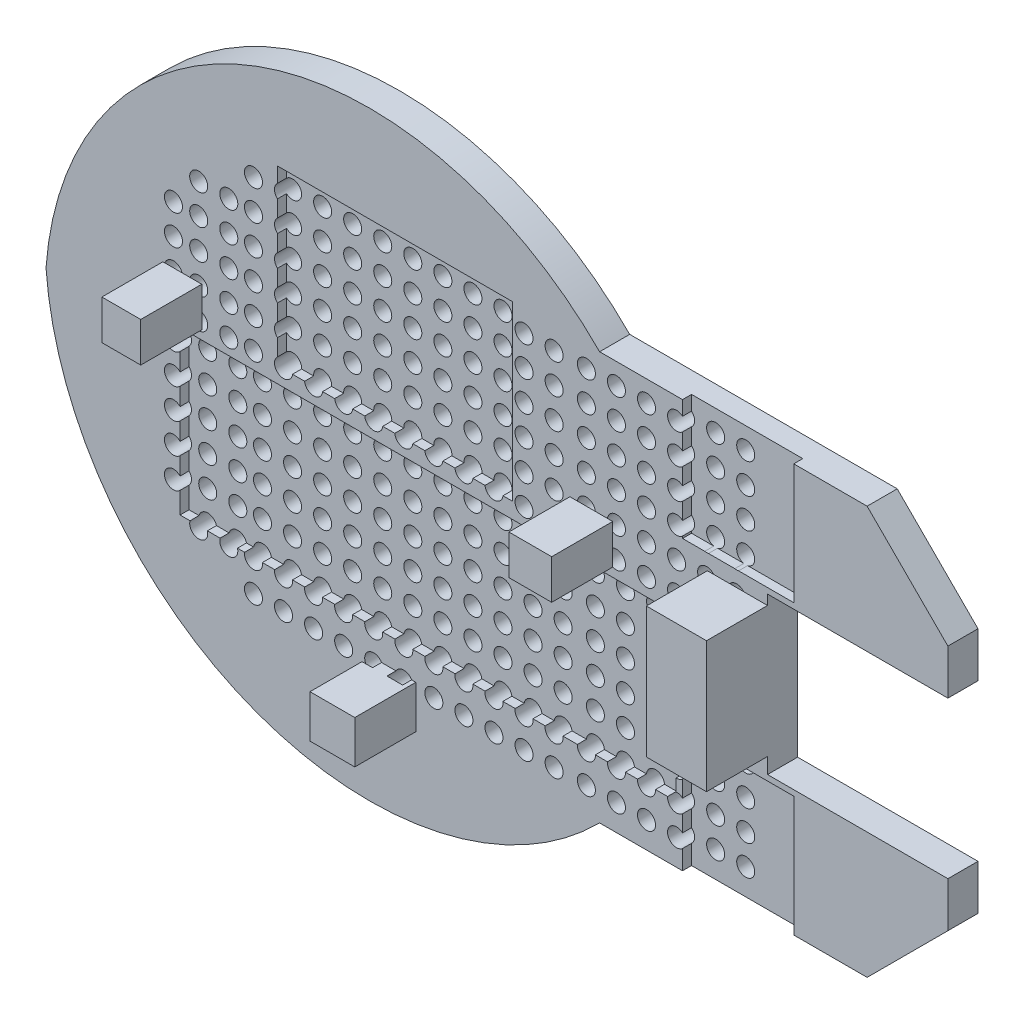
from build123d import *

# Parameters (mm, degrees)
BOSS_EXTRUDE1_DEPTH      = 10
BOSS_EXTRUDE1_DEPTH_BACK = 0.01
SKETCH3_W                = 37
SKETCH3_H                = 40
CUT_EXTRUDE1_DEPTH       = 3
SKETCH5_W                = 37
SKETCH5_H                = 40
CUT_EXTRUDE3_DEPTH       = 3
SKETCH7_W                = 165
SKETCH7_H                = 54
CUT_EXTRUDE4_DEPTH       = 3
SKETCH8_W                = 78.2
SKETCH8_H                = 57.5
CUT_EXTRUDE5_DEPTH       = 3
SKETCH9_W                = 12.924332112
SKETCH9_H                = 13.143388588
SKETCH9_W_2              = 14.238670971
SKETCH9_W_3              = 14.8958404
SKETCH9_H_2              = 14.23867097
BOSS_EXTRUDE2_DEPTH      = 20.3
SKETCH11_R               = 3
CUT_EXTRUDE12_DEPTH      = 13
CUT_EXTRUDE13_REACH      = 263.683
SKETCH12_R               = 3
CUT_EXTRUDE14_REACH      = 263.683
SKETCH13_R               = 3
SKETCH14_R               = 3
CUT_EXTRUDE16_DEPTH      = 10.01
SKETCH15_W               = 20
SKETCH15_H               = 43.5
BOSS_EXTRUDE3_DEPTH      = 20.3


with BuildPart() as part:
    # Sketch1 → Boss-Extrude1 (new, two sides: drawn at the far end of the back side and taken through both)
    with BuildSketch(Plane.XY.offset(-BOSS_EXTRUDE1_DEPTH_BACK)):
        with BuildLine():
            Line((0, 0), (0, -26))
            Line((0, -26), (60, -26))
            Line((60, -26), (60, -41))
            Line((60, -41), (33.129942315, -67.870057685))
            Line((33.129942315, -67.870057685), (-55.850057685, -67.870057685))
            ThreePointArc((-55.850057685, -67.870057685), (-169.745893523, -93.14097487), (-240, 0))
            ThreePointArc((-240, 0), (-169.745893523, 93.14097487), (-55.850057685, 67.870057685))
            Line((-55.850057685, 67.870057685), (33.129942315, 67.870057685))
            Line((33.129942315, 67.870057685), (60, 41))
            Line((60, 41), (60, 26))
            Line((60, 26), (0, 26))
            Line((0, 26), (0, 0))
        make_face()
    extrude(amount=BOSS_EXTRUDE1_DEPTH + BOSS_EXTRUDE1_DEPTH_BACK)

    # Sketch3 → Cut-Extrude1 (cut)
    with BuildSketch(Plane.XY.offset(10)):
        with Locations((-9.773002586, 47.870057685)):
            Rectangle(SKETCH3_W, SKETCH3_H)
    extrude(amount=-CUT_EXTRUDE1_DEPTH, mode=Mode.SUBTRACT)

    # Sketch5 → Cut-Extrude3 (cut)
    with BuildSketch(Plane.XY.offset(10)):
        with Locations((-9.773002586, -47.870057685)):
            Rectangle(SKETCH5_W, SKETCH5_H)
    extrude(amount=-CUT_EXTRUDE3_DEPTH, mode=Mode.SUBTRACT)

    # Sketch7 → Cut-Extrude4 (cut)
    with BuildSketch(Plane.XY.offset(10)):
        with Locations((-112.913094129, -21.943838981)):
            Rectangle(SKETCH7_W, SKETCH7_H)
    extrude(amount=-CUT_EXTRUDE4_DEPTH, mode=Mode.SUBTRACT)

    # Sketch8 → Cut-Extrude5 (cut)
    with BuildSketch(Plane.XY.offset(10)):
        with Locations((-123.892735612, 39.063262975)):
            Rectangle(SKETCH8_W, SKETCH8_H)
    extrude(amount=-CUT_EXTRUDE5_DEPTH, mode=Mode.SUBTRACT)

    # Sketch9 → Boss-Extrude2 (add)
    with BuildSketch(Plane.XY.offset(10)):
        with Locations((-194.646396461, 14.582539194)):
            Rectangle(SKETCH9_W, SKETCH9_H)
        with Locations((-58.612324577, 14.582539194)):
            Rectangle(SKETCH9_W_2, SKETCH9_H)
        with Locations((-124.438795754, -65.044490001)):
            Rectangle(SKETCH9_W_3, SKETCH9_H_2)
    extrude(amount=BOSS_EXTRUDE2_DEPTH)

    # Sketch11 → Cut-Extrude12 (cut)
    with BuildSketch(Plane(origin=(0, 0, -0.01), x_dir=(-1, 0, 0), z_dir=(0, 0, -1))):
        with Locations((70.989015497, 60.584399251)):
            Circle(SKETCH11_R)
        with Locations((80.989015497, 60.584399251)):
            Circle(SKETCH11_R)
        with Locations((90.989015497, 60.584399251)):
            Circle(SKETCH11_R)
        with Locations((100.989015497, 60.584399251)):
            Circle(SKETCH11_R)
        with Locations((110.989015497, 60.584399251)):
            Circle(SKETCH11_R)
        with Locations((120.989015497, 60.584399251)):
            Circle(SKETCH11_R)
        with Locations((130.989015497, 60.584399251)):
            Circle(SKETCH11_R)
        with Locations((140.989015497, 60.584399251)):
            Circle(SKETCH11_R)
        with Locations((150.989015497, 60.584399251)):
            Circle(SKETCH11_R)
        with Locations((160.989015497, 60.584399251)):
            Circle(SKETCH11_R)
        with Locations((170.989015497, 60.584399251)):
            Circle(SKETCH11_R)
        with Locations((80.989015497, 50.584399251)):
            Circle(SKETCH11_R)
        with Locations((90.989015497, 50.584399251)):
            Circle(SKETCH11_R)
        with Locations((100.989015497, 50.584399251)):
            Circle(SKETCH11_R)
        with Locations((110.989015497, 50.584399251)):
            Circle(SKETCH11_R)
        with Locations((120.989015497, 50.584399251)):
            Circle(SKETCH11_R)
        with Locations((130.989015497, 50.584399251)):
            Circle(SKETCH11_R)
        with Locations((140.989015497, 50.584399251)):
            Circle(SKETCH11_R)
        with Locations((150.989015497, 50.584399251)):
            Circle(SKETCH11_R)
        with Locations((160.989015497, 50.584399251)):
            Circle(SKETCH11_R)
        with Locations((170.989015497, 50.584399251)):
            Circle(SKETCH11_R)
        with Locations((80.989015497, 40.584399251)):
            Circle(SKETCH11_R)
        with Locations((90.989015497, 40.584399251)):
            Circle(SKETCH11_R)
        with Locations((100.989015497, 40.584399251)):
            Circle(SKETCH11_R)
        with Locations((110.989015497, 40.584399251)):
            Circle(SKETCH11_R)
        with Locations((120.989015497, 40.584399251)):
            Circle(SKETCH11_R)
        with Locations((130.989015497, 40.584399251)):
            Circle(SKETCH11_R)
        with Locations((140.989015497, 40.584399251)):
            Circle(SKETCH11_R)
        with Locations((150.989015497, 40.584399251)):
            Circle(SKETCH11_R)
        with Locations((160.989015497, 40.584399251)):
            Circle(SKETCH11_R)
        with Locations((170.989015497, 40.584399251)):
            Circle(SKETCH11_R)
        with Locations((80.989015497, 30.584399251)):
            Circle(SKETCH11_R)
        with Locations((90.989015497, 30.584399251)):
            Circle(SKETCH11_R)
        with Locations((100.989015497, 30.584399251)):
            Circle(SKETCH11_R)
        with Locations((110.989015497, 30.584399251)):
            Circle(SKETCH11_R)
        with Locations((120.989015497, 30.584399251)):
            Circle(SKETCH11_R)
        with Locations((130.989015497, 30.584399251)):
            Circle(SKETCH11_R)
        with Locations((140.989015497, 30.584399251)):
            Circle(SKETCH11_R)
        with Locations((150.989015497, 30.584399251)):
            Circle(SKETCH11_R)
        with Locations((160.989015497, 30.584399251)):
            Circle(SKETCH11_R)
        with Locations((170.989015497, 30.584399251)):
            Circle(SKETCH11_R)
        with Locations((80.989015497, 20.584399251)):
            Circle(SKETCH11_R)
        with Locations((90.989015497, 20.584399251)):
            Circle(SKETCH11_R)
        with Locations((100.989015497, 20.584399251)):
            Circle(SKETCH11_R)
        with Locations((110.989015497, 20.584399251)):
            Circle(SKETCH11_R)
        with Locations((120.989015497, 20.584399251)):
            Circle(SKETCH11_R)
        with Locations((130.989015497, 20.584399251)):
            Circle(SKETCH11_R)
        with Locations((140.989015497, 20.584399251)):
            Circle(SKETCH11_R)
        with Locations((150.989015497, 20.584399251)):
            Circle(SKETCH11_R)
        with Locations((160.989015497, 20.584399251)):
            Circle(SKETCH11_R)
        with Locations((170.989015497, 20.584399251)):
            Circle(SKETCH11_R)
        with Locations((80.989015497, 10.584399251)):
            Circle(SKETCH11_R)
        with Locations((90.989015497, 10.584399251)):
            Circle(SKETCH11_R)
        with Locations((100.989015497, 10.584399251)):
            Circle(SKETCH11_R)
        with Locations((110.989015497, 10.584399251)):
            Circle(SKETCH11_R)
        with Locations((120.989015497, 10.584399251)):
            Circle(SKETCH11_R)
        with Locations((130.989015497, 10.584399251)):
            Circle(SKETCH11_R)
        with Locations((140.989015497, 10.584399251)):
            Circle(SKETCH11_R)
        with Locations((150.989015497, 10.584399251)):
            Circle(SKETCH11_R)
        with Locations((160.989015497, 10.584399251)):
            Circle(SKETCH11_R)
        with Locations((170.989015497, 10.584399251)):
            Circle(SKETCH11_R)
        with Locations((80.989015497, 0.584399251)):
            Circle(SKETCH11_R)
        with Locations((90.989015497, 0.584399251)):
            Circle(SKETCH11_R)
        with Locations((100.989015497, 0.584399251)):
            Circle(SKETCH11_R)
        with Locations((110.989015497, 0.584399251)):
            Circle(SKETCH11_R)
        with Locations((120.989015497, 0.584399251)):
            Circle(SKETCH11_R)
        with Locations((130.989015497, 0.584399251)):
            Circle(SKETCH11_R)
        with Locations((140.989015497, 0.584399251)):
            Circle(SKETCH11_R)
        with Locations((150.989015497, 0.584399251)):
            Circle(SKETCH11_R)
        with Locations((160.989015497, 0.584399251)):
            Circle(SKETCH11_R)
        with Locations((170.989015497, 0.584399251)):
            Circle(SKETCH11_R)
        with Locations((80.989015497, -9.415600749)):
            Circle(SKETCH11_R)
        with Locations((90.989015497, -9.415600749)):
            Circle(SKETCH11_R)
        with Locations((100.989015497, -9.415600749)):
            Circle(SKETCH11_R)
        with Locations((110.989015497, -9.415600749)):
            Circle(SKETCH11_R)
        with Locations((120.989015497, -9.415600749)):
            Circle(SKETCH11_R)
        with Locations((130.989015497, -9.415600749)):
            Circle(SKETCH11_R)
        with Locations((140.989015497, -9.415600749)):
            Circle(SKETCH11_R)
        with Locations((150.989015497, -9.415600749)):
            Circle(SKETCH11_R)
        with Locations((160.989015497, -9.415600749)):
            Circle(SKETCH11_R)
        with Locations((170.989015497, -9.415600749)):
            Circle(SKETCH11_R)
        with Locations((80.989015497, -19.415600749)):
            Circle(SKETCH11_R)
        with Locations((90.989015497, -19.415600749)):
            Circle(SKETCH11_R)
        with Locations((100.989015497, -19.415600749)):
            Circle(SKETCH11_R)
        with Locations((110.989015497, -19.415600749)):
            Circle(SKETCH11_R)
        with Locations((120.989015497, -19.415600749)):
            Circle(SKETCH11_R)
        with Locations((130.989015497, -19.415600749)):
            Circle(SKETCH11_R)
        with Locations((140.989015497, -19.415600749)):
            Circle(SKETCH11_R)
        with Locations((150.989015497, -19.415600749)):
            Circle(SKETCH11_R)
        with Locations((160.989015497, -19.415600749)):
            Circle(SKETCH11_R)
        with Locations((170.989015497, -19.415600749)):
            Circle(SKETCH11_R)
        with Locations((80.989015497, -29.415600749)):
            Circle(SKETCH11_R)
        with Locations((90.989015497, -29.415600749)):
            Circle(SKETCH11_R)
        with Locations((100.989015497, -29.415600749)):
            Circle(SKETCH11_R)
        with Locations((110.989015497, -29.415600749)):
            Circle(SKETCH11_R)
        with Locations((120.989015497, -29.415600749)):
            Circle(SKETCH11_R)
        with Locations((130.989015497, -29.415600749)):
            Circle(SKETCH11_R)
        with Locations((140.989015497, -29.415600749)):
            Circle(SKETCH11_R)
        with Locations((150.989015497, -29.415600749)):
            Circle(SKETCH11_R)
        with Locations((160.989015497, -29.415600749)):
            Circle(SKETCH11_R)
        with Locations((170.989015497, -29.415600749)):
            Circle(SKETCH11_R)
        with Locations((80.989015497, -39.415600749)):
            Circle(SKETCH11_R)
        with Locations((90.989015497, -39.415600749)):
            Circle(SKETCH11_R)
        with Locations((100.989015497, -39.415600749)):
            Circle(SKETCH11_R)
        with Locations((110.989015497, -39.415600749)):
            Circle(SKETCH11_R)
        with Locations((120.989015497, -39.415600749)):
            Circle(SKETCH11_R)
        with Locations((130.989015497, -39.415600749)):
            Circle(SKETCH11_R)
        with Locations((140.989015497, -39.415600749)):
            Circle(SKETCH11_R)
        with Locations((150.989015497, -39.415600749)):
            Circle(SKETCH11_R)
        with Locations((160.989015497, -39.415600749)):
            Circle(SKETCH11_R)
        with Locations((170.989015497, -39.415600749)):
            Circle(SKETCH11_R)
        with Locations((80.989015497, -49.415600749)):
            Circle(SKETCH11_R)
        with Locations((90.989015497, -49.415600749)):
            Circle(SKETCH11_R)
        with Locations((100.989015497, -49.415600749)):
            Circle(SKETCH11_R)
        with Locations((110.989015497, -49.415600749)):
            Circle(SKETCH11_R)
        with Locations((120.989015497, -49.415600749)):
            Circle(SKETCH11_R)
        with Locations((130.989015497, -49.415600749)):
            Circle(SKETCH11_R)
        with Locations((140.989015497, -49.415600749)):
            Circle(SKETCH11_R)
        with Locations((150.989015497, -49.415600749)):
            Circle(SKETCH11_R)
        with Locations((160.989015497, -49.415600749)):
            Circle(SKETCH11_R)
        with Locations((170.989015497, -49.415600749)):
            Circle(SKETCH11_R)
        with Locations((80.989015497, -59.415600749)):
            Circle(SKETCH11_R)
        with Locations((90.989015497, -59.415600749)):
            Circle(SKETCH11_R)
        with Locations((100.989015497, -59.415600749)):
            Circle(SKETCH11_R)
        with Locations((110.989015497, -59.415600749)):
            Circle(SKETCH11_R)
        with Locations((120.989015497, -59.415600749)):
            Circle(SKETCH11_R)
        with Locations((130.989015497, -59.415600749)):
            Circle(SKETCH11_R)
        with Locations((140.989015497, -59.415600749)):
            Circle(SKETCH11_R)
        with Locations((150.989015497, -59.415600749)):
            Circle(SKETCH11_R)
        with Locations((160.989015497, -59.415600749)):
            Circle(SKETCH11_R)
        with Locations((170.989015497, -59.415600749)):
            Circle(SKETCH11_R)
        with Locations((70.989015497, 50.584399251)):
            Circle(SKETCH11_R)
        with Locations((70.989015497, 40.584399251)):
            Circle(SKETCH11_R)
        with Locations((70.989015497, 30.584399251)):
            Circle(SKETCH11_R)
        with Locations((70.989015497, 20.584399251)):
            Circle(SKETCH11_R)
        with Locations((70.989015497, 10.584399251)):
            Circle(SKETCH11_R)
        with Locations((70.989015497, 0.584399251)):
            Circle(SKETCH11_R)
        with Locations((70.989015497, -9.415600749)):
            Circle(SKETCH11_R)
        with Locations((70.989015497, -19.415600749)):
            Circle(SKETCH11_R)
        with Locations((70.989015497, -29.415600749)):
            Circle(SKETCH11_R)
        with Locations((70.989015497, -39.415600749)):
            Circle(SKETCH11_R)
        with Locations((70.989015497, -49.415600749)):
            Circle(SKETCH11_R)
        with Locations((70.989015497, -59.415600749)):
            Circle(SKETCH11_R)
    extrude(amount=-CUT_EXTRUDE12_DEPTH, mode=Mode.SUBTRACT)

    # Cut-Extrude13: up to this face of the body (flat: up to its plane)
    cut_extrude13_end = Plane(part.part.faces().sort_by_distance((56.396717085, 33.5, 10))[0])
    # Sketch12 → Cut-Extrude13 (cut, up to the picked face)
    with BuildSketch(Plane(origin=(0, 0, -0.01), x_dir=(-1, 0, 0), z_dir=(0, 0, -1)), mode=Mode.PRIVATE) as cut_extrude13_sk1:
        with Locations((179.20291487, 50.26025315)):
            Circle(SKETCH12_R)
    cut_extrude13_tool1 = split(extrude(cut_extrude13_sk1.sketch, amount=-CUT_EXTRUDE13_REACH, mode=Mode.PRIVATE), bisect_by=cut_extrude13_end, keep=Keep.BOTH, mode=Mode.PRIVATE)
    # Sketch12 → Cut-Extrude13 (cut, up to the picked face)
    with BuildSketch(Plane(origin=(0, 0, -0.01), x_dir=(-1, 0, 0), z_dir=(0, 0, -1)), mode=Mode.PRIVATE) as cut_extrude13_sk2:
        with Locations((189.20291487, 50.26025315)):
            Circle(SKETCH12_R)
    cut_extrude13_tool2 = split(extrude(cut_extrude13_sk2.sketch, amount=-CUT_EXTRUDE13_REACH, mode=Mode.PRIVATE), bisect_by=cut_extrude13_end, keep=Keep.BOTH, mode=Mode.PRIVATE)
    # Sketch12 → Cut-Extrude13 (cut, up to the picked face)
    with BuildSketch(Plane(origin=(0, 0, -0.01), x_dir=(-1, 0, 0), z_dir=(0, 0, -1)), mode=Mode.PRIVATE) as cut_extrude13_sk3:
        with Locations((189.20291487, 40.26025315)):
            Circle(SKETCH12_R)
    cut_extrude13_tool3 = split(extrude(cut_extrude13_sk3.sketch, amount=-CUT_EXTRUDE13_REACH, mode=Mode.PRIVATE), bisect_by=cut_extrude13_end, keep=Keep.BOTH, mode=Mode.PRIVATE)
    # Sketch12 → Cut-Extrude13 (cut, up to the picked face)
    with BuildSketch(Plane(origin=(0, 0, -0.01), x_dir=(-1, 0, 0), z_dir=(0, 0, -1)), mode=Mode.PRIVATE) as cut_extrude13_sk4:
        with Locations((189.20291487, 30.26025315)):
            Circle(SKETCH12_R)
    cut_extrude13_tool4 = split(extrude(cut_extrude13_sk4.sketch, amount=-CUT_EXTRUDE13_REACH, mode=Mode.PRIVATE), bisect_by=cut_extrude13_end, keep=Keep.BOTH, mode=Mode.PRIVATE)
    # Sketch12 → Cut-Extrude13 (cut, up to the picked face)
    with BuildSketch(Plane(origin=(0, 0, -0.01), x_dir=(-1, 0, 0), z_dir=(0, 0, -1)), mode=Mode.PRIVATE) as cut_extrude13_sk5:
        with Locations((189.20291487, 20.26025315)):
            Circle(SKETCH12_R)
    cut_extrude13_tool5 = split(extrude(cut_extrude13_sk5.sketch, amount=-CUT_EXTRUDE13_REACH, mode=Mode.PRIVATE), bisect_by=cut_extrude13_end, keep=Keep.BOTH, mode=Mode.PRIVATE)
    # Sketch12 → Cut-Extrude13 (cut, up to the picked face)
    with BuildSketch(Plane(origin=(0, 0, -0.01), x_dir=(-1, 0, 0), z_dir=(0, 0, -1)), mode=Mode.PRIVATE) as cut_extrude13_sk6:
        with Locations((189.20291487, 10.26025315)):
            Circle(SKETCH12_R)
    cut_extrude13_tool6 = split(extrude(cut_extrude13_sk6.sketch, amount=-CUT_EXTRUDE13_REACH, mode=Mode.PRIVATE), bisect_by=cut_extrude13_end, keep=Keep.BOTH, mode=Mode.PRIVATE)
    # Sketch12 → Cut-Extrude13 (cut, up to the picked face)
    with BuildSketch(Plane(origin=(0, 0, -0.01), x_dir=(-1, 0, 0), z_dir=(0, 0, -1)), mode=Mode.PRIVATE) as cut_extrude13_sk7:
        with Locations((189.20291487, 0.26025315)):
            Circle(SKETCH12_R)
    cut_extrude13_tool7 = split(extrude(cut_extrude13_sk7.sketch, amount=-CUT_EXTRUDE13_REACH, mode=Mode.PRIVATE), bisect_by=cut_extrude13_end, keep=Keep.BOTH, mode=Mode.PRIVATE)
    # Sketch12 → Cut-Extrude13 (cut, up to the picked face)
    with BuildSketch(Plane(origin=(0, 0, -0.01), x_dir=(-1, 0, 0), z_dir=(0, 0, -1)), mode=Mode.PRIVATE) as cut_extrude13_sk8:
        with Locations((189.20291487, -9.73974685)):
            Circle(SKETCH12_R)
    cut_extrude13_tool8 = split(extrude(cut_extrude13_sk8.sketch, amount=-CUT_EXTRUDE13_REACH, mode=Mode.PRIVATE), bisect_by=cut_extrude13_end, keep=Keep.BOTH, mode=Mode.PRIVATE)
    # Sketch12 → Cut-Extrude13 (cut, up to the picked face)
    with BuildSketch(Plane(origin=(0, 0, -0.01), x_dir=(-1, 0, 0), z_dir=(0, 0, -1)), mode=Mode.PRIVATE) as cut_extrude13_sk9:
        with Locations((189.20291487, -19.73974685)):
            Circle(SKETCH12_R)
    cut_extrude13_tool9 = split(extrude(cut_extrude13_sk9.sketch, amount=-CUT_EXTRUDE13_REACH, mode=Mode.PRIVATE), bisect_by=cut_extrude13_end, keep=Keep.BOTH, mode=Mode.PRIVATE)
    # Sketch12 → Cut-Extrude13 (cut, up to the picked face)
    with BuildSketch(Plane(origin=(0, 0, -0.01), x_dir=(-1, 0, 0), z_dir=(0, 0, -1)), mode=Mode.PRIVATE) as cut_extrude13_sk10:
        with Locations((189.20291487, -29.73974685)):
            Circle(SKETCH12_R)
    cut_extrude13_tool10 = split(extrude(cut_extrude13_sk10.sketch, amount=-CUT_EXTRUDE13_REACH, mode=Mode.PRIVATE), bisect_by=cut_extrude13_end, keep=Keep.BOTH, mode=Mode.PRIVATE)
    # Sketch12 → Cut-Extrude13 (cut, up to the picked face)
    with BuildSketch(Plane(origin=(0, 0, -0.01), x_dir=(-1, 0, 0), z_dir=(0, 0, -1)), mode=Mode.PRIVATE) as cut_extrude13_sk11:
        with Locations((189.20291487, -39.73974685)):
            Circle(SKETCH12_R)
    cut_extrude13_tool11 = split(extrude(cut_extrude13_sk11.sketch, amount=-CUT_EXTRUDE13_REACH, mode=Mode.PRIVATE), bisect_by=cut_extrude13_end, keep=Keep.BOTH, mode=Mode.PRIVATE)
    # Sketch12 → Cut-Extrude13 (cut, up to the picked face)
    with BuildSketch(Plane(origin=(0, 0, -0.01), x_dir=(-1, 0, 0), z_dir=(0, 0, -1)), mode=Mode.PRIVATE) as cut_extrude13_sk12:
        with Locations((189.20291487, -49.73974685)):
            Circle(SKETCH12_R)
    cut_extrude13_tool12 = split(extrude(cut_extrude13_sk12.sketch, amount=-CUT_EXTRUDE13_REACH, mode=Mode.PRIVATE), bisect_by=cut_extrude13_end, keep=Keep.BOTH, mode=Mode.PRIVATE)
    # Sketch12 → Cut-Extrude13 (cut, up to the picked face)
    with BuildSketch(Plane(origin=(0, 0, -0.01), x_dir=(-1, 0, 0), z_dir=(0, 0, -1)), mode=Mode.PRIVATE) as cut_extrude13_sk13:
        with Locations((179.20291487, 40.26025315)):
            Circle(SKETCH12_R)
    cut_extrude13_tool13 = split(extrude(cut_extrude13_sk13.sketch, amount=-CUT_EXTRUDE13_REACH, mode=Mode.PRIVATE), bisect_by=cut_extrude13_end, keep=Keep.BOTH, mode=Mode.PRIVATE)
    # Sketch12 → Cut-Extrude13 (cut, up to the picked face)
    with BuildSketch(Plane(origin=(0, 0, -0.01), x_dir=(-1, 0, 0), z_dir=(0, 0, -1)), mode=Mode.PRIVATE) as cut_extrude13_sk14:
        with Locations((179.20291487, 30.26025315)):
            Circle(SKETCH12_R)
    cut_extrude13_tool14 = split(extrude(cut_extrude13_sk14.sketch, amount=-CUT_EXTRUDE13_REACH, mode=Mode.PRIVATE), bisect_by=cut_extrude13_end, keep=Keep.BOTH, mode=Mode.PRIVATE)
    # Sketch12 → Cut-Extrude13 (cut, up to the picked face)
    with BuildSketch(Plane(origin=(0, 0, -0.01), x_dir=(-1, 0, 0), z_dir=(0, 0, -1)), mode=Mode.PRIVATE) as cut_extrude13_sk15:
        with Locations((179.20291487, 20.26025315)):
            Circle(SKETCH12_R)
    cut_extrude13_tool15 = split(extrude(cut_extrude13_sk15.sketch, amount=-CUT_EXTRUDE13_REACH, mode=Mode.PRIVATE), bisect_by=cut_extrude13_end, keep=Keep.BOTH, mode=Mode.PRIVATE)
    # Sketch12 → Cut-Extrude13 (cut, up to the picked face)
    with BuildSketch(Plane(origin=(0, 0, -0.01), x_dir=(-1, 0, 0), z_dir=(0, 0, -1)), mode=Mode.PRIVATE) as cut_extrude13_sk16:
        with Locations((179.20291487, 10.26025315)):
            Circle(SKETCH12_R)
    cut_extrude13_tool16 = split(extrude(cut_extrude13_sk16.sketch, amount=-CUT_EXTRUDE13_REACH, mode=Mode.PRIVATE), bisect_by=cut_extrude13_end, keep=Keep.BOTH, mode=Mode.PRIVATE)
    # Sketch12 → Cut-Extrude13 (cut, up to the picked face)
    with BuildSketch(Plane(origin=(0, 0, -0.01), x_dir=(-1, 0, 0), z_dir=(0, 0, -1)), mode=Mode.PRIVATE) as cut_extrude13_sk17:
        with Locations((179.20291487, 0.26025315)):
            Circle(SKETCH12_R)
    cut_extrude13_tool17 = split(extrude(cut_extrude13_sk17.sketch, amount=-CUT_EXTRUDE13_REACH, mode=Mode.PRIVATE), bisect_by=cut_extrude13_end, keep=Keep.BOTH, mode=Mode.PRIVATE)
    # Sketch12 → Cut-Extrude13 (cut, up to the picked face)
    with BuildSketch(Plane(origin=(0, 0, -0.01), x_dir=(-1, 0, 0), z_dir=(0, 0, -1)), mode=Mode.PRIVATE) as cut_extrude13_sk18:
        with Locations((179.20291487, -9.73974685)):
            Circle(SKETCH12_R)
    cut_extrude13_tool18 = split(extrude(cut_extrude13_sk18.sketch, amount=-CUT_EXTRUDE13_REACH, mode=Mode.PRIVATE), bisect_by=cut_extrude13_end, keep=Keep.BOTH, mode=Mode.PRIVATE)
    # Sketch12 → Cut-Extrude13 (cut, up to the picked face)
    with BuildSketch(Plane(origin=(0, 0, -0.01), x_dir=(-1, 0, 0), z_dir=(0, 0, -1)), mode=Mode.PRIVATE) as cut_extrude13_sk19:
        with Locations((179.20291487, -19.73974685)):
            Circle(SKETCH12_R)
    cut_extrude13_tool19 = split(extrude(cut_extrude13_sk19.sketch, amount=-CUT_EXTRUDE13_REACH, mode=Mode.PRIVATE), bisect_by=cut_extrude13_end, keep=Keep.BOTH, mode=Mode.PRIVATE)
    # Sketch12 → Cut-Extrude13 (cut, up to the picked face)
    with BuildSketch(Plane(origin=(0, 0, -0.01), x_dir=(-1, 0, 0), z_dir=(0, 0, -1)), mode=Mode.PRIVATE) as cut_extrude13_sk20:
        with Locations((179.20291487, -29.73974685)):
            Circle(SKETCH12_R)
    cut_extrude13_tool20 = split(extrude(cut_extrude13_sk20.sketch, amount=-CUT_EXTRUDE13_REACH, mode=Mode.PRIVATE), bisect_by=cut_extrude13_end, keep=Keep.BOTH, mode=Mode.PRIVATE)
    # Sketch12 → Cut-Extrude13 (cut, up to the picked face)
    with BuildSketch(Plane(origin=(0, 0, -0.01), x_dir=(-1, 0, 0), z_dir=(0, 0, -1)), mode=Mode.PRIVATE) as cut_extrude13_sk21:
        with Locations((179.20291487, -39.73974685)):
            Circle(SKETCH12_R)
    cut_extrude13_tool21 = split(extrude(cut_extrude13_sk21.sketch, amount=-CUT_EXTRUDE13_REACH, mode=Mode.PRIVATE), bisect_by=cut_extrude13_end, keep=Keep.BOTH, mode=Mode.PRIVATE)
    # Sketch12 → Cut-Extrude13 (cut, up to the picked face)
    with BuildSketch(Plane(origin=(0, 0, -0.01), x_dir=(-1, 0, 0), z_dir=(0, 0, -1)), mode=Mode.PRIVATE) as cut_extrude13_sk22:
        with Locations((179.20291487, -49.73974685)):
            Circle(SKETCH12_R)
    cut_extrude13_tool22 = split(extrude(cut_extrude13_sk22.sketch, amount=-CUT_EXTRUDE13_REACH, mode=Mode.PRIVATE), bisect_by=cut_extrude13_end, keep=Keep.BOTH, mode=Mode.PRIVATE)
    add(cut_extrude13_tool1.solids().sort_by(Axis((-179.202915, 50.260253, -0.01), (0, 0, 1)))[0], mode=Mode.SUBTRACT)
    add(cut_extrude13_tool2.solids().sort_by(Axis((-189.202915, 50.260253, -0.01), (0, 0, 1)))[0], mode=Mode.SUBTRACT)
    add(cut_extrude13_tool3.solids().sort_by(Axis((-189.202915, 40.260253, -0.01), (0, 0, 1)))[0], mode=Mode.SUBTRACT)
    add(cut_extrude13_tool4.solids().sort_by(Axis((-189.202915, 30.260253, -0.01), (0, 0, 1)))[0], mode=Mode.SUBTRACT)
    add(cut_extrude13_tool5.solids().sort_by(Axis((-189.202915, 20.260253, -0.01), (0, 0, 1)))[0], mode=Mode.SUBTRACT)
    add(cut_extrude13_tool6.solids().sort_by(Axis((-189.202915, 10.260253, -0.01), (0, 0, 1)))[0], mode=Mode.SUBTRACT)
    add(cut_extrude13_tool7.solids().sort_by(Axis((-189.202915, 0.260253, -0.01), (0, 0, 1)))[0], mode=Mode.SUBTRACT)
    add(cut_extrude13_tool8.solids().sort_by(Axis((-189.202915, -9.739747, -0.01), (0, 0, 1)))[0], mode=Mode.SUBTRACT)
    add(cut_extrude13_tool9.solids().sort_by(Axis((-189.202915, -19.739747, -0.01), (0, 0, 1)))[0], mode=Mode.SUBTRACT)
    add(cut_extrude13_tool10.solids().sort_by(Axis((-189.202915, -29.739747, -0.01), (0, 0, 1)))[0], mode=Mode.SUBTRACT)
    add(cut_extrude13_tool11.solids().sort_by(Axis((-189.202915, -39.739747, -0.01), (0, 0, 1)))[0], mode=Mode.SUBTRACT)
    add(cut_extrude13_tool12.solids().sort_by(Axis((-189.202915, -49.739747, -0.01), (0, 0, 1)))[0], mode=Mode.SUBTRACT)
    add(cut_extrude13_tool13.solids().sort_by(Axis((-179.202915, 40.260253, -0.01), (0, 0, 1)))[0], mode=Mode.SUBTRACT)
    add(cut_extrude13_tool14.solids().sort_by(Axis((-179.202915, 30.260253, -0.01), (0, 0, 1)))[0], mode=Mode.SUBTRACT)
    add(cut_extrude13_tool15.solids().sort_by(Axis((-179.202915, 20.260253, -0.01), (0, 0, 1)))[0], mode=Mode.SUBTRACT)
    add(cut_extrude13_tool16.solids().sort_by(Axis((-179.202915, 10.260253, -0.01), (0, 0, 1)))[0], mode=Mode.SUBTRACT)
    add(cut_extrude13_tool17.solids().sort_by(Axis((-179.202915, 0.260253, -0.01), (0, 0, 1)))[0], mode=Mode.SUBTRACT)
    add(cut_extrude13_tool18.solids().sort_by(Axis((-179.202915, -9.739747, -0.01), (0, 0, 1)))[0], mode=Mode.SUBTRACT)
    add(cut_extrude13_tool19.solids().sort_by(Axis((-179.202915, -19.739747, -0.01), (0, 0, 1)))[0], mode=Mode.SUBTRACT)
    add(cut_extrude13_tool20.solids().sort_by(Axis((-179.202915, -29.739747, -0.01), (0, 0, 1)))[0], mode=Mode.SUBTRACT)
    add(cut_extrude13_tool21.solids().sort_by(Axis((-179.202915, -39.739747, -0.01), (0, 0, 1)))[0], mode=Mode.SUBTRACT)
    add(cut_extrude13_tool22.solids().sort_by(Axis((-179.202915, -49.739747, -0.01), (0, 0, 1)))[0], mode=Mode.SUBTRACT)

    # Cut-Extrude14: up to this face of the body (flat: up to its plane)
    cut_extrude14_end = Plane(part.part.faces().sort_by_distance((56.396717085, 33.5, 10))[0])
    # Sketch13 → Cut-Extrude14 (cut, up to the picked face)
    with BuildSketch(Plane(origin=(0, 0, -0.01), x_dir=(-1, 0, 0), z_dir=(0, 0, -1)), mode=Mode.PRIVATE) as cut_extrude14_sk1:
        with Locations((197.603658893, 40.21214694)):
            Circle(SKETCH13_R)
    cut_extrude14_tool1 = split(extrude(cut_extrude14_sk1.sketch, amount=-CUT_EXTRUDE14_REACH, mode=Mode.PRIVATE), bisect_by=cut_extrude14_end, keep=Keep.BOTH, mode=Mode.PRIVATE)
    # Sketch13 → Cut-Extrude14 (cut, up to the picked face)
    with BuildSketch(Plane(origin=(0, 0, -0.01), x_dir=(-1, 0, 0), z_dir=(0, 0, -1)), mode=Mode.PRIVATE) as cut_extrude14_sk2:
        with Locations((197.603658893, 30.21214694)):
            Circle(SKETCH13_R)
    cut_extrude14_tool2 = split(extrude(cut_extrude14_sk2.sketch, amount=-CUT_EXTRUDE14_REACH, mode=Mode.PRIVATE), bisect_by=cut_extrude14_end, keep=Keep.BOTH, mode=Mode.PRIVATE)
    # Sketch13 → Cut-Extrude14 (cut, up to the picked face)
    with BuildSketch(Plane(origin=(0, 0, -0.01), x_dir=(-1, 0, 0), z_dir=(0, 0, -1)), mode=Mode.PRIVATE) as cut_extrude14_sk3:
        with Locations((197.603658893, 20.21214694)):
            Circle(SKETCH13_R)
    cut_extrude14_tool3 = split(extrude(cut_extrude14_sk3.sketch, amount=-CUT_EXTRUDE14_REACH, mode=Mode.PRIVATE), bisect_by=cut_extrude14_end, keep=Keep.BOTH, mode=Mode.PRIVATE)
    # Sketch13 → Cut-Extrude14 (cut, up to the picked face)
    with BuildSketch(Plane(origin=(0, 0, -0.01), x_dir=(-1, 0, 0), z_dir=(0, 0, -1)), mode=Mode.PRIVATE) as cut_extrude14_sk4:
        with Locations((197.603658893, 10.21214694)):
            Circle(SKETCH13_R)
    cut_extrude14_tool4 = split(extrude(cut_extrude14_sk4.sketch, amount=-CUT_EXTRUDE14_REACH, mode=Mode.PRIVATE), bisect_by=cut_extrude14_end, keep=Keep.BOTH, mode=Mode.PRIVATE)
    # Sketch13 → Cut-Extrude14 (cut, up to the picked face)
    with BuildSketch(Plane(origin=(0, 0, -0.01), x_dir=(-1, 0, 0), z_dir=(0, 0, -1)), mode=Mode.PRIVATE) as cut_extrude14_sk5:
        with Locations((197.603658893, 0.21214694)):
            Circle(SKETCH13_R)
    cut_extrude14_tool5 = split(extrude(cut_extrude14_sk5.sketch, amount=-CUT_EXTRUDE14_REACH, mode=Mode.PRIVATE), bisect_by=cut_extrude14_end, keep=Keep.BOTH, mode=Mode.PRIVATE)
    # Sketch13 → Cut-Extrude14 (cut, up to the picked face)
    with BuildSketch(Plane(origin=(0, 0, -0.01), x_dir=(-1, 0, 0), z_dir=(0, 0, -1)), mode=Mode.PRIVATE) as cut_extrude14_sk6:
        with Locations((197.603658893, -9.78785306)):
            Circle(SKETCH13_R)
    cut_extrude14_tool6 = split(extrude(cut_extrude14_sk6.sketch, amount=-CUT_EXTRUDE14_REACH, mode=Mode.PRIVATE), bisect_by=cut_extrude14_end, keep=Keep.BOTH, mode=Mode.PRIVATE)
    # Sketch13 → Cut-Extrude14 (cut, up to the picked face)
    with BuildSketch(Plane(origin=(0, 0, -0.01), x_dir=(-1, 0, 0), z_dir=(0, 0, -1)), mode=Mode.PRIVATE) as cut_extrude14_sk7:
        with Locations((197.603658893, -19.78785306)):
            Circle(SKETCH13_R)
    cut_extrude14_tool7 = split(extrude(cut_extrude14_sk7.sketch, amount=-CUT_EXTRUDE14_REACH, mode=Mode.PRIVATE), bisect_by=cut_extrude14_end, keep=Keep.BOTH, mode=Mode.PRIVATE)
    # Sketch13 → Cut-Extrude14 (cut, up to the picked face)
    with BuildSketch(Plane(origin=(0, 0, -0.01), x_dir=(-1, 0, 0), z_dir=(0, 0, -1)), mode=Mode.PRIVATE) as cut_extrude14_sk8:
        with Locations((197.603658893, -29.78785306)):
            Circle(SKETCH13_R)
    cut_extrude14_tool8 = split(extrude(cut_extrude14_sk8.sketch, amount=-CUT_EXTRUDE14_REACH, mode=Mode.PRIVATE), bisect_by=cut_extrude14_end, keep=Keep.BOTH, mode=Mode.PRIVATE)
    # Sketch13 → Cut-Extrude14 (cut, up to the picked face)
    with BuildSketch(Plane(origin=(0, 0, -0.01), x_dir=(-1, 0, 0), z_dir=(0, 0, -1)), mode=Mode.PRIVATE) as cut_extrude14_sk9:
        with Locations((197.603658893, -39.78785306)):
            Circle(SKETCH13_R)
    cut_extrude14_tool9 = split(extrude(cut_extrude14_sk9.sketch, amount=-CUT_EXTRUDE14_REACH, mode=Mode.PRIVATE), bisect_by=cut_extrude14_end, keep=Keep.BOTH, mode=Mode.PRIVATE)
    add(cut_extrude14_tool1.solids().sort_by(Axis((-197.603659, 40.212147, -0.01), (0, 0, 1)))[0], mode=Mode.SUBTRACT)
    add(cut_extrude14_tool2.solids().sort_by(Axis((-197.603659, 30.212147, -0.01), (0, 0, 1)))[0], mode=Mode.SUBTRACT)
    add(cut_extrude14_tool3.solids().sort_by(Axis((-197.603659, 20.212147, -0.01), (0, 0, 1)))[0], mode=Mode.SUBTRACT)
    add(cut_extrude14_tool4.solids().sort_by(Axis((-197.603659, 10.212147, -0.01), (0, 0, 1)))[0], mode=Mode.SUBTRACT)
    add(cut_extrude14_tool5.solids().sort_by(Axis((-197.603659, 0.212147, -0.01), (0, 0, 1)))[0], mode=Mode.SUBTRACT)
    add(cut_extrude14_tool6.solids().sort_by(Axis((-197.603659, -9.787853, -0.01), (0, 0, 1)))[0], mode=Mode.SUBTRACT)
    add(cut_extrude14_tool7.solids().sort_by(Axis((-197.603659, -19.787853, -0.01), (0, 0, 1)))[0], mode=Mode.SUBTRACT)
    add(cut_extrude14_tool8.solids().sort_by(Axis((-197.603659, -29.787853, -0.01), (0, 0, 1)))[0], mode=Mode.SUBTRACT)
    add(cut_extrude14_tool9.solids().sort_by(Axis((-197.603659, -39.787853, -0.01), (0, 0, 1)))[0], mode=Mode.SUBTRACT)

    # Sketch14 → Cut-Extrude16 (cut)
    with BuildSketch(Plane(origin=(0, 0, -0.01), x_dir=(-1, 0, 0), z_dir=(0, 0, -1))):
        with Locations((60.25524815, 60.803455728)):
            Circle(SKETCH14_R)
        with Locations((50.25524815, 60.803455728)):
            Circle(SKETCH14_R)
        with Locations((40.25524815, 60.803455728)):
            Circle(SKETCH14_R)
        with Locations((30.25524815, 60.803455728)):
            Circle(SKETCH14_R)
        with Locations((20.25524815, 60.803455728)):
            Circle(SKETCH14_R)
        with Locations((10.25524815, 60.803455728)):
            Circle(SKETCH14_R)
        with Locations((50.25524815, 50.803455728)):
            Circle(SKETCH14_R)
        with Locations((40.25524815, 50.803455728)):
            Circle(SKETCH14_R)
        with Locations((30.25524815, 50.803455728)):
            Circle(SKETCH14_R)
        with Locations((20.25524815, 50.803455728)):
            Circle(SKETCH14_R)
        with Locations((10.25524815, 50.803455728)):
            Circle(SKETCH14_R)
        with Locations((50.25524815, 40.803455728)):
            Circle(SKETCH14_R)
        with Locations((40.25524815, 40.803455728)):
            Circle(SKETCH14_R)
        with Locations((30.25524815, 40.803455728)):
            Circle(SKETCH14_R)
        with Locations((20.25524815, 40.803455728)):
            Circle(SKETCH14_R)
        with Locations((10.25524815, 40.803455728)):
            Circle(SKETCH14_R)
        with Locations((50.25524815, 30.803455728)):
            Circle(SKETCH14_R)
        with Locations((40.25524815, 30.803455728)):
            Circle(SKETCH14_R)
        with Locations((30.25524815, 30.803455728)):
            Circle(SKETCH14_R)
        with Locations((20.25524815, 30.803455728)):
            Circle(SKETCH14_R)
        with Locations((10.25524815, 30.803455728)):
            Circle(SKETCH14_R)
        with Locations((50.25524815, 20.803455728)):
            Circle(SKETCH14_R)
        with Locations((40.25524815, 20.803455728)):
            Circle(SKETCH14_R)
        with Locations((30.25524815, 20.803455728)):
            Circle(SKETCH14_R)
        with Locations((20.25524815, 20.803455728)):
            Circle(SKETCH14_R)
        with Locations((10.25524815, 20.803455728)):
            Circle(SKETCH14_R)
        with Locations((50.25524815, 10.803455728)):
            Circle(SKETCH14_R)
        with Locations((40.25524815, 10.803455728)):
            Circle(SKETCH14_R)
        with Locations((30.25524815, 10.803455728)):
            Circle(SKETCH14_R)
        with Locations((20.25524815, 10.803455728)):
            Circle(SKETCH14_R)
        with Locations((10.25524815, 10.803455728)):
            Circle(SKETCH14_R)
        with Locations((50.25524815, 0.803455728)):
            Circle(SKETCH14_R)
        with Locations((40.25524815, 0.803455728)):
            Circle(SKETCH14_R)
        with Locations((30.25524815, 0.803455728)):
            Circle(SKETCH14_R)
        with Locations((20.25524815, 0.803455728)):
            Circle(SKETCH14_R)
        with Locations((10.25524815, 0.803455728)):
            Circle(SKETCH14_R)
        with Locations((50.25524815, -9.196544272)):
            Circle(SKETCH14_R)
        with Locations((40.25524815, -9.196544272)):
            Circle(SKETCH14_R)
        with Locations((30.25524815, -9.196544272)):
            Circle(SKETCH14_R)
        with Locations((20.25524815, -9.196544272)):
            Circle(SKETCH14_R)
        with Locations((10.25524815, -9.196544272)):
            Circle(SKETCH14_R)
        with Locations((50.25524815, -19.196544272)):
            Circle(SKETCH14_R)
        with Locations((40.25524815, -19.196544272)):
            Circle(SKETCH14_R)
        with Locations((30.25524815, -19.196544272)):
            Circle(SKETCH14_R)
        with Locations((20.25524815, -19.196544272)):
            Circle(SKETCH14_R)
        with Locations((10.25524815, -19.196544272)):
            Circle(SKETCH14_R)
        with Locations((50.25524815, -29.196544272)):
            Circle(SKETCH14_R)
        with Locations((40.25524815, -29.196544272)):
            Circle(SKETCH14_R)
        with Locations((30.25524815, -29.196544272)):
            Circle(SKETCH14_R)
        with Locations((20.25524815, -29.196544272)):
            Circle(SKETCH14_R)
        with Locations((10.25524815, -29.196544272)):
            Circle(SKETCH14_R)
        with Locations((50.25524815, -39.196544272)):
            Circle(SKETCH14_R)
        with Locations((40.25524815, -39.196544272)):
            Circle(SKETCH14_R)
        with Locations((30.25524815, -39.196544272)):
            Circle(SKETCH14_R)
        with Locations((20.25524815, -39.196544272)):
            Circle(SKETCH14_R)
        with Locations((10.25524815, -39.196544272)):
            Circle(SKETCH14_R)
        with Locations((50.25524815, -49.196544272)):
            Circle(SKETCH14_R)
        with Locations((40.25524815, -49.196544272)):
            Circle(SKETCH14_R)
        with Locations((30.25524815, -49.196544272)):
            Circle(SKETCH14_R)
        with Locations((20.25524815, -49.196544272)):
            Circle(SKETCH14_R)
        with Locations((10.25524815, -49.196544272)):
            Circle(SKETCH14_R)
        with Locations((50.25524815, -59.196544272)):
            Circle(SKETCH14_R)
        with Locations((40.25524815, -59.196544272)):
            Circle(SKETCH14_R)
        with Locations((30.25524815, -59.196544272)):
            Circle(SKETCH14_R)
        with Locations((20.25524815, -59.196544272)):
            Circle(SKETCH14_R)
        with Locations((10.25524815, -59.196544272)):
            Circle(SKETCH14_R)
        with Locations((60.25524815, 50.803455728)):
            Circle(SKETCH14_R)
        with Locations((60.25524815, 40.803455728)):
            Circle(SKETCH14_R)
        with Locations((60.25524815, 30.803455728)):
            Circle(SKETCH14_R)
        with Locations((60.25524815, 20.803455728)):
            Circle(SKETCH14_R)
        with Locations((60.25524815, 10.803455728)):
            Circle(SKETCH14_R)
        with Locations((60.25524815, 0.803455728)):
            Circle(SKETCH14_R)
        with Locations((60.25524815, -9.196544272)):
            Circle(SKETCH14_R)
        with Locations((60.25524815, -19.196544272)):
            Circle(SKETCH14_R)
        with Locations((60.25524815, -29.196544272)):
            Circle(SKETCH14_R)
        with Locations((60.25524815, -39.196544272)):
            Circle(SKETCH14_R)
        with Locations((60.25524815, -49.196544272)):
            Circle(SKETCH14_R)
        with Locations((60.25524815, -59.196544272)):
            Circle(SKETCH14_R)
    extrude(amount=-CUT_EXTRUDE16_DEPTH, mode=Mode.SUBTRACT)

    # Sketch15 → Boss-Extrude3 (add)
    with BuildSketch(Plane.XY.offset(10)):
        with Locations((-10, 0.951564885)):
            Rectangle(SKETCH15_W, SKETCH15_H)
    extrude(amount=BOSS_EXTRUDE3_DEPTH)


solid = part.part
